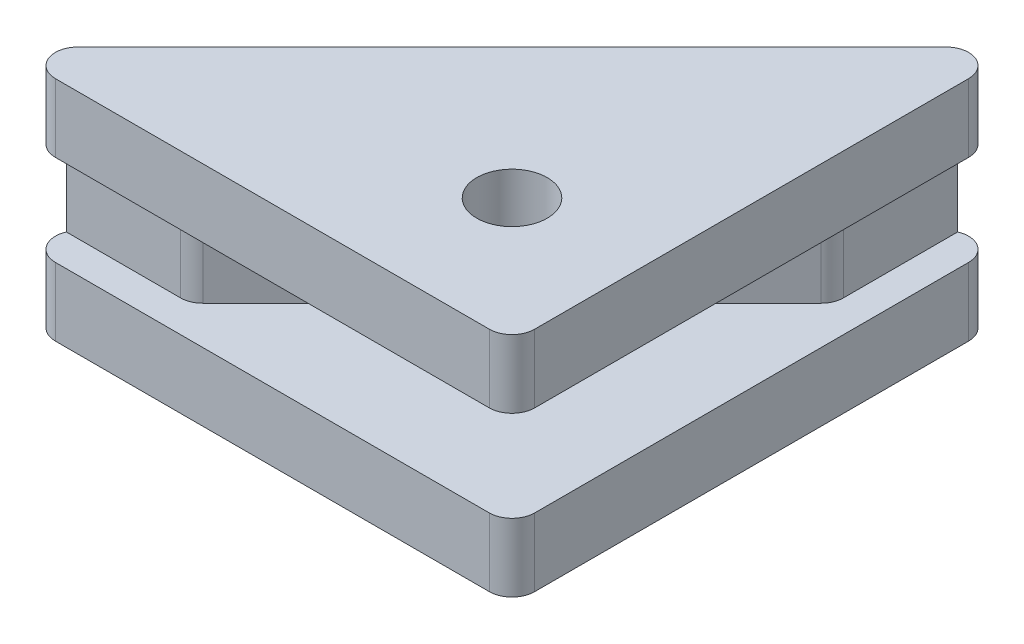
from build123d import *

# Parameters (mm, degrees)
EXTRUDE_1_DEPTH          = 6
EXTRUDE_2_DEPTH          = 8
EXTRUDE_START            = -8
EXTRUDE_3_DEPTH          = 6
CUT_EXTRUDE_1_DEPTH      = 67.708320321
CUT_EXTRUDE_1_DEPTH_BACK = 8
SKETCH_3_R               = 2.75
FILLET_1_R               = 2
SKETCH_4_R               = 3.1
CUT_EXTRUDE_2_DEPTH      = 7


with BuildPart() as part:
    # 草图1 → 凸台-拉伸1 (new body)
    with BuildSketch(Plane(origin=(0, 0, 0), x_dir=(1, 0, 0), z_dir=(0, 1, 0))):
        Polygon((0, 0), (-45, 0), (0, 45), align=None)
    extrude(amount=EXTRUDE_1_DEPTH)

    # 草图2 → 凸台-拉伸2 (add)
    with BuildSketch(Plane.XZ):
        Polygon((-2.8, -42.2), (-2.8, -31.141125497), (-31.141125497, -2.8), (-42.2, -2.8), align=None)
    extrude(amount=EXTRUDE_2_DEPTH)

    # 草图1<3> → 凸台-拉伸3 (add)
    with BuildSketch(Plane(origin=(0, 0, 0), x_dir=(1, 0, 0), z_dir=(0, 1, 0)).offset(EXTRUDE_START)):
        Polygon((0, 0), (-45, 0), (0, 45), align=None)
    extrude(amount=-EXTRUDE_3_DEPTH)

    # 草图3 → 切除-拉伸1 (cut, two sides: drawn at the far end of the back side and taken through both)
    with BuildSketch(Plane.XZ.offset(14).offset(-CUT_EXTRUDE_1_DEPTH_BACK)):
        with Locations(Location((-13, -13, 0), (0, 0, 90))):
            Circle(SKETCH_3_R)
    extrude(amount=CUT_EXTRUDE_1_DEPTH + CUT_EXTRUDE_1_DEPTH_BACK, mode=Mode.SUBTRACT)

    # 圆角1
    # the kernel refuses this fillet: 2 mm, written as the material it takes off along each edge
    with BuildSketch(Plane(origin=(-2.8, 0, -31.141125497), x_dir=(0, 0, -1), z_dir=(0, -1, 0))) as fillet_1_piece_1:
        with BuildLine():
            CenterArc((FILLET_1_R * 0.414213562373, -FILLET_1_R), FILLET_1_R, 90, 45)
            Line((-FILLET_1_R * 0.292893218813, -FILLET_1_R * 0.292893218813), (0, 0))
            Line((0, 0), (FILLET_1_R * 0.414213562373, 0))
        make_face()
    extrude(amount=8, mode=Mode.SUBTRACT)
    with BuildSketch(Plane(origin=(-31.141125497, 0, -2.8), x_dir=(-1, 0, 0), z_dir=(0, -1, 0))) as fillet_1_piece_2:
        with BuildLine():
            CenterArc((FILLET_1_R * 0.414213562373, FILLET_1_R), FILLET_1_R, 225, 45)
            Line((-FILLET_1_R * 0.292893218813, FILLET_1_R * 0.292893218813), (0, 0))
            Line((0, 0), (FILLET_1_R * 0.414213562373, 0))
        make_face()
    extrude(amount=8, mode=Mode.SUBTRACT)
    with BuildSketch(Plane(origin=(-45, 4.071067812, 0), x_dir=(1, 0, 0), z_dir=(0, -1, 0)), Plane(origin=(-45, -12.071067812, 0), x_dir=(0.7071067811865471, 0, -0.7071067811865478), z_dir=(0, 1, 0))) as fillet_1_piece_3:
        with BuildLine():
            CenterArc((FILLET_1_R * 2.41421356237, -FILLET_1_R), FILLET_1_R, 90, 135)
            Line((FILLET_1_R * 1.70710678119, -FILLET_1_R * 1.70710678119), (0, 0))
            Line((0, 0), (FILLET_1_R * 2.41421356237, 0))
        make_face()
    extrude(amount=30.142135624, mode=Mode.SUBTRACT)
    with BuildSketch(Plane(origin=(0, 4.071067812, -45), x_dir=(0, 0, 1), z_dir=(0, -1, 0)), Plane(origin=(0, -12.071067812, -45), x_dir=(-0.7071067811865477, 0, 0.7071067811865474), z_dir=(0, 1, 0))) as fillet_1_piece_4:
        with BuildLine():
            CenterArc((FILLET_1_R * 2.41421356237, FILLET_1_R), FILLET_1_R, 135, 135)
            Line((FILLET_1_R * 1.70710678119, FILLET_1_R * 1.70710678119), (0, 0))
            Line((0, 0), (FILLET_1_R * 2.41421356237, 0))
        make_face()
    extrude(amount=30.142135624, mode=Mode.SUBTRACT)
    with BuildSketch(Plane(origin=(0, -3, 0), x_dir=(-1, 0, 0), z_dir=(0, -1, 0)), Plane(origin=(0, -5, 0), x_dir=(0, 0, -1), z_dir=(0, 1, 0))) as fillet_1_piece_5:
        with BuildLine():
            CenterArc((FILLET_1_R, FILLET_1_R), FILLET_1_R, 180, 90)
            Line((0, FILLET_1_R), (0, 0))
            Line((0, 0), (FILLET_1_R, 0))
        make_face()
    extrude(amount=16, mode=Mode.SUBTRACT)

    # 草图4 → 切除-拉伸2 (cut)
    with BuildSketch(Plane(origin=(0, 6, 0), x_dir=(1, 0, 0), z_dir=(0, 1, 0))):
        with Locations(Location((-11, 11, 0), (0, 0, 270))):
            Circle(SKETCH_4_R)
    extrude(amount=-CUT_EXTRUDE_2_DEPTH, mode=Mode.SUBTRACT)


solid = part.part
